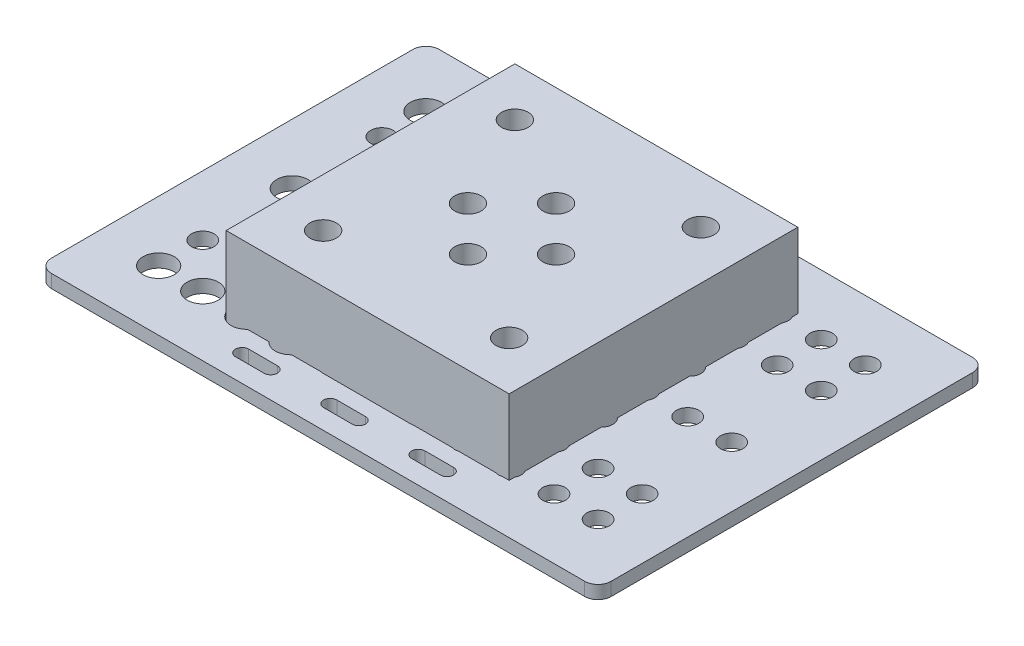
from build123d import *

# Parameters (mm, degrees)
V_SLOT_GANTRY_PLATE_20_80MM_OUTLINE_R   = 3.55
V_SLOT_GANTRY_PLATE_20_80MM_OUTLINE_R_2 = 2.55
V_SLOT_GANTRY_PLATE_20_80MM_DEPTH       = 3
SKETCH1_W                               = 64.2
SKETCH1_H                               = 65.5
SKETCH1_R                               = 4.125
SKETCH1_R_2                             = 3
BOSS_EXTRUDE1_DEPTH                     = 20
SKETCH1_3_R                             = 4.125
CUT_EXTRUDE1_DEPTH                      = 3.5


# Read off the part's stored shape, not the designer's step: V-Slot Gantry Plate 20-80mm
with BuildPart() as part:
    # V-Slot Gantry Plate 20-80mm outline → V-Slot Gantry Plate 20-80mm (new body)
    with BuildSketch(Plane(origin=(0, 0, 0), x_dir=(1, 0, 0), z_dir=(0, 1, 0))):
        with BuildLine():
            ThreePointArc((-63.5, -41), (-62.621320344, -43.121320344), (-60.5, -44))
            Line((-60.5, -44), (60.5, -44))
            ThreePointArc((60.5, -44), (62.621320344, -43.121320344), (63.5, -41))
            Line((63.5, -41), (63.5, 41))
            ThreePointArc((63.5, 41), (62.621320344, 43.121320344), (60.5, 44))
            Line((60.5, 44), (-60.5, 44))
            ThreePointArc((-60.5, 44), (-62.621320344, 43.121320344), (-63.5, 41))
            Line((-63.5, 41), (-63.5, -41))
        make_face()
        with Locations((-49.85, -30.32)):
            Circle(V_SLOT_GANTRY_PLATE_20_80MM_OUTLINE_R, mode=Mode.SUBTRACT)
        with Locations((-39.85, -30.32)):
            Circle(V_SLOT_GANTRY_PLATE_20_80MM_OUTLINE_R, mode=Mode.SUBTRACT)
        with BuildLine():
            Line((-23.25, -36.5), (-16.75, -36.5))
            ThreePointArc((-16.75, -36.5), (-15.25, -38), (-16.75, -39.5))
            Line((-16.75, -39.5), (-23.25, -39.5))
            ThreePointArc((-23.25, -39.5), (-24.75, -38), (-23.25, -36.5))
        make_face(mode=Mode.SUBTRACT)
        with Locations((-29.85, -30.32)):
            Circle(V_SLOT_GANTRY_PLATE_20_80MM_OUTLINE_R, mode=Mode.SUBTRACT)
        with Locations((-19.85, -30.32)):
            Circle(V_SLOT_GANTRY_PLATE_20_80MM_OUTLINE_R, mode=Mode.SUBTRACT)
        with Locations((-49.85, -20.32)):
            Circle(V_SLOT_GANTRY_PLATE_20_80MM_OUTLINE_R_2, mode=Mode.SUBTRACT)
        with Locations((-39.85, -20.32)):
            Circle(V_SLOT_GANTRY_PLATE_20_80MM_OUTLINE_R_2, mode=Mode.SUBTRACT)
        with Locations((-29.85, -20.32)):
            Circle(V_SLOT_GANTRY_PLATE_20_80MM_OUTLINE_R_2, mode=Mode.SUBTRACT)
        with Locations((-19.85, -20.32)):
            Circle(V_SLOT_GANTRY_PLATE_20_80MM_OUTLINE_R_2, mode=Mode.SUBTRACT)
        with Locations((-9.69, -20.32)):
            Circle(V_SLOT_GANTRY_PLATE_20_80MM_OUTLINE_R_2, mode=Mode.SUBTRACT)
        with Locations((-14.825, -14.825)):
            Circle(V_SLOT_GANTRY_PLATE_20_80MM_OUTLINE_R_2, mode=Mode.SUBTRACT)
        with Locations((-30.32, -10)):
            Circle(V_SLOT_GANTRY_PLATE_20_80MM_OUTLINE_R_2, mode=Mode.SUBTRACT)
        with Locations((-20.32, -10)):
            Circle(V_SLOT_GANTRY_PLATE_20_80MM_OUTLINE_R_2, mode=Mode.SUBTRACT)
        with BuildLine():
            Line((-3.25, -36.5), (3.25, -36.5))
            ThreePointArc((3.25, -36.5), (4.75, -38), (3.25, -39.5))
            Line((3.25, -39.5), (-3.25, -39.5))
            ThreePointArc((-3.25, -39.5), (-4.75, -38), (-3.25, -36.5))
        make_face(mode=Mode.SUBTRACT)
        with BuildLine():
            Line((23.25, -39.5), (16.75, -39.5))
            ThreePointArc((16.75, -39.5), (15.25, -38), (16.75, -36.5))
            Line((16.75, -36.5), (23.25, -36.5))
            ThreePointArc((23.25, -36.5), (24.75, -38), (23.25, -39.5))
        make_face(mode=Mode.SUBTRACT)
        with BuildLine():
            Line((-10, -27.82), (10, -27.82))
            ThreePointArc((10, -27.82), (12.5, -30.32), (10, -32.82))
            Line((10, -32.82), (-10, -32.82))
            ThreePointArc((-10, -32.82), (-12.5, -30.32), (-10, -27.82))
        make_face(mode=Mode.SUBTRACT)
        with Locations((19.85, -30.32)):
            Circle(V_SLOT_GANTRY_PLATE_20_80MM_OUTLINE_R_2, mode=Mode.SUBTRACT)
        with Locations((29.85, -30.32)):
            Circle(V_SLOT_GANTRY_PLATE_20_80MM_OUTLINE_R_2, mode=Mode.SUBTRACT)
        with Locations((39.85, -30.32)):
            Circle(V_SLOT_GANTRY_PLATE_20_80MM_OUTLINE_R_2, mode=Mode.SUBTRACT)
        with Locations((49.85, -30.32)):
            Circle(V_SLOT_GANTRY_PLATE_20_80MM_OUTLINE_R_2, mode=Mode.SUBTRACT)
        with Locations((0, -20.32)):
            Circle(V_SLOT_GANTRY_PLATE_20_80MM_OUTLINE_R_2, mode=Mode.SUBTRACT)
        with Locations((9.69, -20.32)):
            Circle(V_SLOT_GANTRY_PLATE_20_80MM_OUTLINE_R_2, mode=Mode.SUBTRACT)
        with Locations((14.825, -14.825)):
            Circle(V_SLOT_GANTRY_PLATE_20_80MM_OUTLINE_R_2, mode=Mode.SUBTRACT)
        with Locations((19.85, -20.32)):
            Circle(V_SLOT_GANTRY_PLATE_20_80MM_OUTLINE_R_2, mode=Mode.SUBTRACT)
        with Locations((29.85, -20.32)):
            Circle(V_SLOT_GANTRY_PLATE_20_80MM_OUTLINE_R_2, mode=Mode.SUBTRACT)
        with Locations((0, -10)):
            Circle(V_SLOT_GANTRY_PLATE_20_80MM_OUTLINE_R_2, mode=Mode.SUBTRACT)
        with Locations((20.32, -10)):
            Circle(V_SLOT_GANTRY_PLATE_20_80MM_OUTLINE_R_2, mode=Mode.SUBTRACT)
        with Locations((30.32, -10)):
            Circle(V_SLOT_GANTRY_PLATE_20_80MM_OUTLINE_R_2, mode=Mode.SUBTRACT)
        with Locations((39.85, -20.32)):
            Circle(V_SLOT_GANTRY_PLATE_20_80MM_OUTLINE_R_2, mode=Mode.SUBTRACT)
        with Locations((49.85, -20.32)):
            Circle(V_SLOT_GANTRY_PLATE_20_80MM_OUTLINE_R_2, mode=Mode.SUBTRACT)
        with Locations((-49.85, 0)):
            Circle(V_SLOT_GANTRY_PLATE_20_80MM_OUTLINE_R, mode=Mode.SUBTRACT)
        with Locations((-39.85, 0)):
            Circle(V_SLOT_GANTRY_PLATE_20_80MM_OUTLINE_R, mode=Mode.SUBTRACT)
        with Locations((-49.85, 20.32)):
            Circle(V_SLOT_GANTRY_PLATE_20_80MM_OUTLINE_R_2, mode=Mode.SUBTRACT)
        with Locations((-39.85, 20.32)):
            Circle(V_SLOT_GANTRY_PLATE_20_80MM_OUTLINE_R_2, mode=Mode.SUBTRACT)
        with Locations((-29.85, 0)):
            Circle(V_SLOT_GANTRY_PLATE_20_80MM_OUTLINE_R, mode=Mode.SUBTRACT)
        with Locations((-19.85, 0)):
            Circle(V_SLOT_GANTRY_PLATE_20_80MM_OUTLINE_R, mode=Mode.SUBTRACT)
        with Locations((-30.32, 10)):
            Circle(V_SLOT_GANTRY_PLATE_20_80MM_OUTLINE_R_2, mode=Mode.SUBTRACT)
        with Locations((-20.32, 10)):
            Circle(V_SLOT_GANTRY_PLATE_20_80MM_OUTLINE_R_2, mode=Mode.SUBTRACT)
        with Locations((-10, 0)):
            Circle(V_SLOT_GANTRY_PLATE_20_80MM_OUTLINE_R_2, mode=Mode.SUBTRACT)
        with Locations((-29.85, 20.32)):
            Circle(V_SLOT_GANTRY_PLATE_20_80MM_OUTLINE_R_2, mode=Mode.SUBTRACT)
        with Locations((-19.85, 20.32)):
            Circle(V_SLOT_GANTRY_PLATE_20_80MM_OUTLINE_R_2, mode=Mode.SUBTRACT)
        with Locations((-14.825, 14.825)):
            Circle(V_SLOT_GANTRY_PLATE_20_80MM_OUTLINE_R_2, mode=Mode.SUBTRACT)
        with Locations((-9.69, 20.32)):
            Circle(V_SLOT_GANTRY_PLATE_20_80MM_OUTLINE_R_2, mode=Mode.SUBTRACT)
        with Locations((-49.85, 30.32)):
            Circle(V_SLOT_GANTRY_PLATE_20_80MM_OUTLINE_R, mode=Mode.SUBTRACT)
        with Locations((-39.85, 30.32)):
            Circle(V_SLOT_GANTRY_PLATE_20_80MM_OUTLINE_R, mode=Mode.SUBTRACT)
        with Locations((-29.85, 30.32)):
            Circle(V_SLOT_GANTRY_PLATE_20_80MM_OUTLINE_R, mode=Mode.SUBTRACT)
        with Locations((-19.85, 30.32)):
            Circle(V_SLOT_GANTRY_PLATE_20_80MM_OUTLINE_R, mode=Mode.SUBTRACT)
        with BuildLine():
            Line((-23.25, 39.5), (-16.75, 39.5))
            ThreePointArc((-16.75, 39.5), (-15.25, 38), (-16.75, 36.5))
            Line((-16.75, 36.5), (-23.25, 36.5))
            ThreePointArc((-23.25, 36.5), (-24.75, 38), (-23.25, 39.5))
        make_face(mode=Mode.SUBTRACT)
        Circle(V_SLOT_GANTRY_PLATE_20_80MM_OUTLINE_R_2, mode=Mode.SUBTRACT)
        with Locations((10, 0)):
            Circle(V_SLOT_GANTRY_PLATE_20_80MM_OUTLINE_R_2, mode=Mode.SUBTRACT)
        with Locations((0, 10)):
            Circle(V_SLOT_GANTRY_PLATE_20_80MM_OUTLINE_R_2, mode=Mode.SUBTRACT)
        with Locations((19.85, 0)):
            Circle(V_SLOT_GANTRY_PLATE_20_80MM_OUTLINE_R_2, mode=Mode.SUBTRACT)
        with Locations((29.85, 0)):
            Circle(V_SLOT_GANTRY_PLATE_20_80MM_OUTLINE_R_2, mode=Mode.SUBTRACT)
        with Locations((20.32, 10)):
            Circle(V_SLOT_GANTRY_PLATE_20_80MM_OUTLINE_R_2, mode=Mode.SUBTRACT)
        with Locations((30.32, 10)):
            Circle(V_SLOT_GANTRY_PLATE_20_80MM_OUTLINE_R_2, mode=Mode.SUBTRACT)
        with Locations((14.825, 14.825)):
            Circle(V_SLOT_GANTRY_PLATE_20_80MM_OUTLINE_R_2, mode=Mode.SUBTRACT)
        with Locations((0, 20.32)):
            Circle(V_SLOT_GANTRY_PLATE_20_80MM_OUTLINE_R_2, mode=Mode.SUBTRACT)
        with Locations((9.69, 20.32)):
            Circle(V_SLOT_GANTRY_PLATE_20_80MM_OUTLINE_R_2, mode=Mode.SUBTRACT)
        with Locations((19.85, 20.32)):
            Circle(V_SLOT_GANTRY_PLATE_20_80MM_OUTLINE_R_2, mode=Mode.SUBTRACT)
        with Locations((29.85, 20.32)):
            Circle(V_SLOT_GANTRY_PLATE_20_80MM_OUTLINE_R_2, mode=Mode.SUBTRACT)
        with Locations((39.85, 0)):
            Circle(V_SLOT_GANTRY_PLATE_20_80MM_OUTLINE_R_2, mode=Mode.SUBTRACT)
        with Locations((49.85, 0)):
            Circle(V_SLOT_GANTRY_PLATE_20_80MM_OUTLINE_R_2, mode=Mode.SUBTRACT)
        with Locations((39.85, 20.32)):
            Circle(V_SLOT_GANTRY_PLATE_20_80MM_OUTLINE_R_2, mode=Mode.SUBTRACT)
        with Locations((49.85, 20.32)):
            Circle(V_SLOT_GANTRY_PLATE_20_80MM_OUTLINE_R_2, mode=Mode.SUBTRACT)
        with BuildLine():
            Line((-10, 32.82), (10, 32.82))
            ThreePointArc((10, 32.82), (12.5, 30.32), (10, 27.82))
            Line((10, 27.82), (-10, 27.82))
            ThreePointArc((-10, 27.82), (-12.5, 30.32), (-10, 32.82))
        make_face(mode=Mode.SUBTRACT)
        with Locations((19.85, 30.32)):
            Circle(V_SLOT_GANTRY_PLATE_20_80MM_OUTLINE_R_2, mode=Mode.SUBTRACT)
        with Locations((29.85, 30.32)):
            Circle(V_SLOT_GANTRY_PLATE_20_80MM_OUTLINE_R_2, mode=Mode.SUBTRACT)
        with BuildLine():
            Line((-3.25, 39.5), (3.25, 39.5))
            ThreePointArc((3.25, 39.5), (4.75, 38), (3.25, 36.5))
            Line((3.25, 36.5), (-3.25, 36.5))
            ThreePointArc((-3.25, 36.5), (-4.75, 38), (-3.25, 39.5))
        make_face(mode=Mode.SUBTRACT)
        with BuildLine():
            Line((23.25, 36.5), (16.75, 36.5))
            ThreePointArc((16.75, 36.5), (15.25, 38), (16.75, 39.5))
            Line((16.75, 39.5), (23.25, 39.5))
            ThreePointArc((23.25, 39.5), (24.75, 38), (23.25, 36.5))
        make_face(mode=Mode.SUBTRACT)
        with Locations((39.85, 30.32)):
            Circle(V_SLOT_GANTRY_PLATE_20_80MM_OUTLINE_R_2, mode=Mode.SUBTRACT)
        with Locations((49.85, 30.32)):
            Circle(V_SLOT_GANTRY_PLATE_20_80MM_OUTLINE_R_2, mode=Mode.SUBTRACT)
    extrude(amount=V_SLOT_GANTRY_PLATE_20_80MM_DEPTH)


with BuildPart() as body_2:
    # Sketch1 → Boss-Extrude1 (new body)
    # profile 1 of 5: a face of its own
    with BuildSketch(Plane(origin=(0, 0, 0), x_dir=(1, 0, 0), z_dir=(0, 1, 0))):
        Rectangle(SKETCH1_W, SKETCH1_H)
        with Locations((21.1, 21.75)):
            Circle(SKETCH1_R, mode=Mode.SUBTRACT)
        with Locations((21.1, -21.75)):
            Circle(SKETCH1_R, mode=Mode.SUBTRACT)
        with Locations((-21.1, -21.75)):
            Circle(SKETCH1_R, mode=Mode.SUBTRACT)
        with Locations((-21.1, 21.75)):
            Circle(SKETCH1_R, mode=Mode.SUBTRACT)
        with Locations(Location((0, -10, 0), (0, 0, 270))):
            Circle(SKETCH1_R_2, mode=Mode.SUBTRACT)
        with Locations(Location((10, 0, 0), (0, 0, 270))):
            Circle(SKETCH1_R_2, mode=Mode.SUBTRACT)
        with Locations(Location((0, 10, 0), (0, 0, 270))):
            Circle(SKETCH1_R_2, mode=Mode.SUBTRACT)
        with Locations(Location((-10, 0, 0), (0, 0, 270))):
            Circle(SKETCH1_R_2, mode=Mode.SUBTRACT)
    # profile 2 of 5: a face of its own
    with BuildSketch(Plane(origin=(0, 0, 0), x_dir=(1, 0, 0), z_dir=(0, 1, 0))):
        with Locations((-21.1, -21.75)):
            Circle(SKETCH1_R)
        with Locations(Location((-21.1, -21.75, 0), (0, 0, 270))):
            Circle(SKETCH1_R_2, mode=Mode.SUBTRACT)
    # profile 3 of 5: a face of its own
    with BuildSketch(Plane(origin=(0, 0, 0), x_dir=(1, 0, 0), z_dir=(0, 1, 0))):
        with Locations((-21.1, 21.75)):
            Circle(SKETCH1_R)
        with Locations(Location((-21.1, 21.75, 0), (0, 0, 270))):
            Circle(SKETCH1_R_2, mode=Mode.SUBTRACT)
    # profile 4 of 5: a face of its own
    with BuildSketch(Plane(origin=(0, 0, 0), x_dir=(1, 0, 0), z_dir=(0, 1, 0))):
        with Locations((21.1, 21.75)):
            Circle(SKETCH1_R)
        with Locations(Location((21.1, 21.75, 0), (0, 0, 270))):
            Circle(SKETCH1_R_2, mode=Mode.SUBTRACT)
    # profile 5 of 5: a face of its own
    with BuildSketch(Plane(origin=(0, 0, 0), x_dir=(1, 0, 0), z_dir=(0, 1, 0))):
        with Locations((21.1, -21.75)):
            Circle(SKETCH1_R)
        with Locations(Location((21.1, -21.75, 0), (0, 0, 270))):
            Circle(SKETCH1_R_2, mode=Mode.SUBTRACT)
    extrude(amount=BOSS_EXTRUDE1_DEPTH)

    # Sketch1<3> → Cut-Extrude1 (cut)
    with BuildSketch(Plane(origin=(0, 0, 0), x_dir=(1, 0, 0), z_dir=(0, 1, 0))):
        with Locations(Location((-21.1, 21.75, 0), (0, 0, 270))):
            Circle(SKETCH1_3_R)
        with Locations(Location((-21.1, -21.75, 0), (0, 0, 270))):
            Circle(SKETCH1_3_R)
        with Locations(Location((21.1, -21.75, 0), (0, 0, 270))):
            Circle(SKETCH1_3_R)
        with Locations(Location((21.1, 21.75, 0), (0, 0, 270))):
            Circle(SKETCH1_3_R)
    extrude(amount=CUT_EXTRUDE1_DEPTH, mode=Mode.SUBTRACT)


solid = Compound([part.part, body_2.part])
